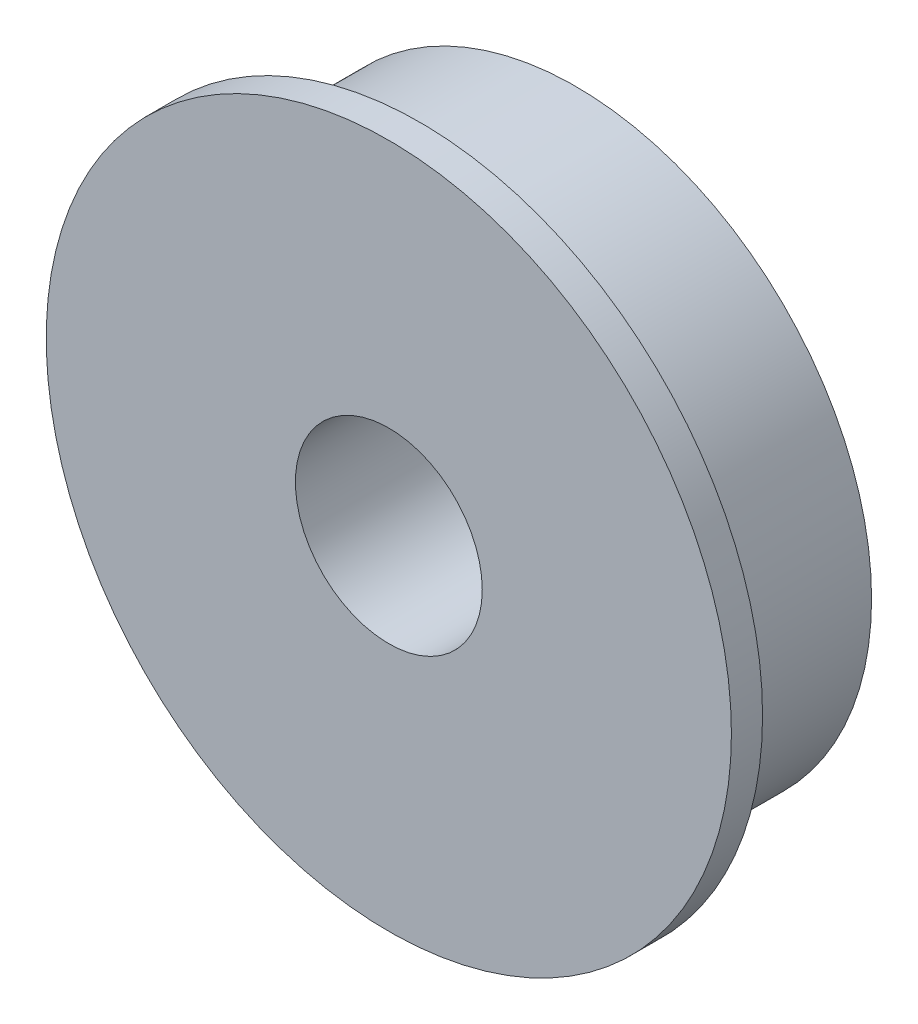
from build123d import *

# Parameters (mm, degrees)
SZKIC1_R                    = 9.5
SZKIC1_R_2                  = 3
DODANIE_WYCI_GNI_CIE1_DEPTH = 6
DODANIE_WYCI_GNI_CIE2_START = -1
SZKIC2_R                    = 11
SZKIC2_R_2                  = 9.5
DODANIE_WYCI_GNI_CIE2_DEPTH = 1


with BuildPart() as part:
    # Szkic1 → Dodanie-wyciągnięcie1 (new body)
    with BuildSketch(Plane.XY):
        Circle(SZKIC1_R)
        Circle(SZKIC1_R_2, mode=Mode.SUBTRACT)
    extrude(amount=DODANIE_WYCI_GNI_CIE1_DEPTH)

    # Szkic2 → Dodanie-wyciągnięcie2 (add)
    with BuildSketch(Plane.XY.offset(6).offset(DODANIE_WYCI_GNI_CIE2_START)):
        Circle(SZKIC2_R)
        Circle(SZKIC2_R_2, mode=Mode.SUBTRACT)
    extrude(amount=DODANIE_WYCI_GNI_CIE2_DEPTH)


solid = part.part
